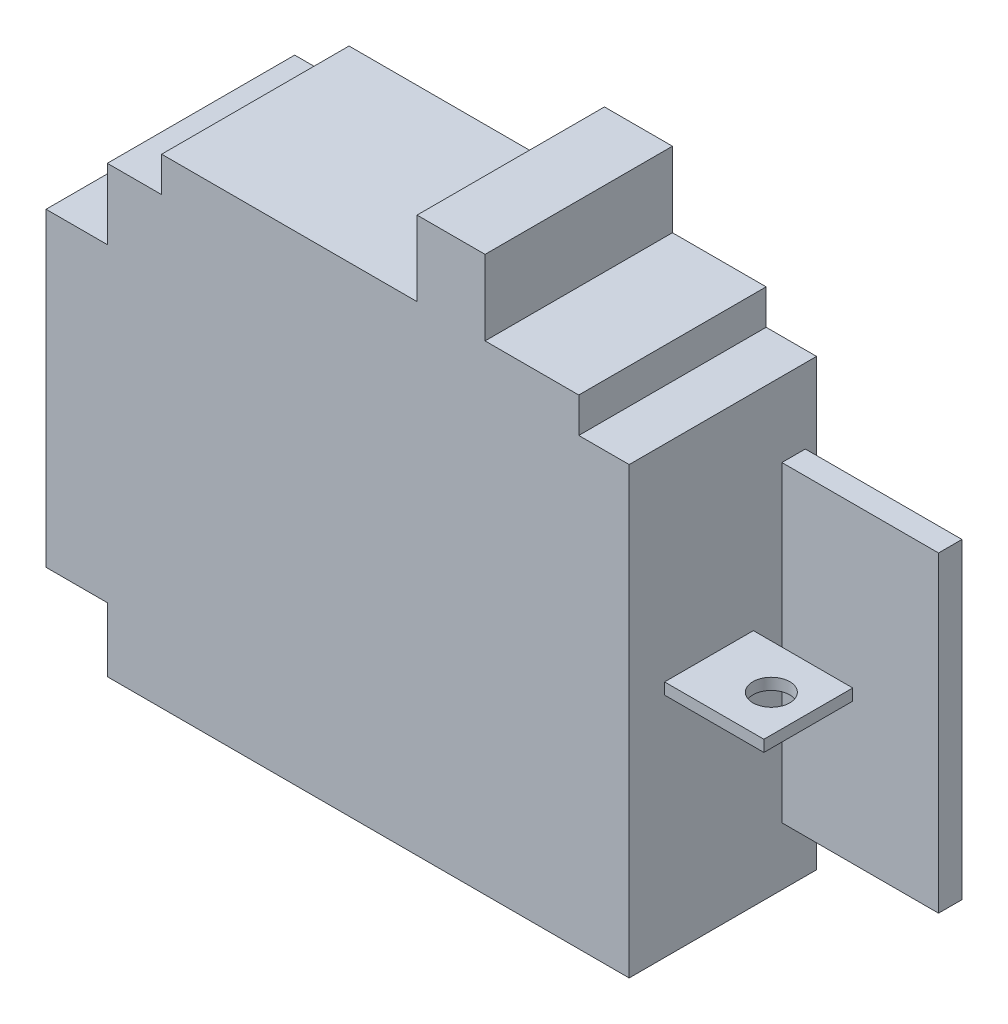
from build123d import *

# Parameters (mm, degrees)
BOSS_EXTRUDE1_DEPTH = 25.4
SKETCH2_W           = 3.175
SKETCH2_H           = 42.291
BOSS_EXTRUDE2_DEPTH = 21.2344
SKETCH3_W           = 12.0396
SKETCH3_H           = 1.5494
BOSS_EXTRUDE3_DEPTH = 13.462
SKETCH4_R           = 2.49555
CUT_EXTRUDE1_DEPTH  = 16.51


with BuildPart() as part:
    # Sketch1 → Boss-Extrude1 (new body)
    with BuildSketch(Plane.XY):
        Polygon((28.5369, 30.1371), (35.3695, 30.1371), (35.3695, -30.1371), (-35.3695, -30.1371), (-35.3695, -21.4503), (-43.6753, -21.4503), (-43.6753, 20.5867), (-35.3695, 20.5867), (-35.3695, 30.1371), (-28.0035, 30.1371), (-28.0035, 34.8869), (6.6167, 34.8869), (6.6167, 45.0469), (15.8369, 45.0469), (15.8369, 34.8869), (28.5369, 34.8869), align=None)
    extrude(amount=BOSS_EXTRUDE1_DEPTH)

    # Sketch2 → Boss-Extrude2 (add)
    with BuildSketch(Plane(origin=(35.3695, 0, 0), x_dir=(0, 0, -1), z_dir=(1, 0, 0))):
        with Locations((-3.1115, -1.11983587)):
            Rectangle(SKETCH2_W, SKETCH2_H)
    extrude(amount=BOSS_EXTRUDE2_DEPTH)

    # Sketch3 → Boss-Extrude3 (add)
    with BuildSketch(Plane(origin=(35.3695, 0, 0), x_dir=(0, 0, -1), z_dir=(1, 0, 0))):
        with Locations((-14.5796, 1.4478)):
            Rectangle(SKETCH3_W, SKETCH3_H)
    extrude(amount=BOSS_EXTRUDE3_DEPTH)

    # Sketch4 → Cut-Extrude1 (cut)
    with BuildSketch(Plane(origin=(0, 2.2225, 0), x_dir=(1, 0, 0), z_dir=(0, 1, 0))):
        with Locations((43.82135, -14.5796)):
            Circle(SKETCH4_R)
    extrude(amount=-CUT_EXTRUDE1_DEPTH, mode=Mode.SUBTRACT)


solid = part.part
